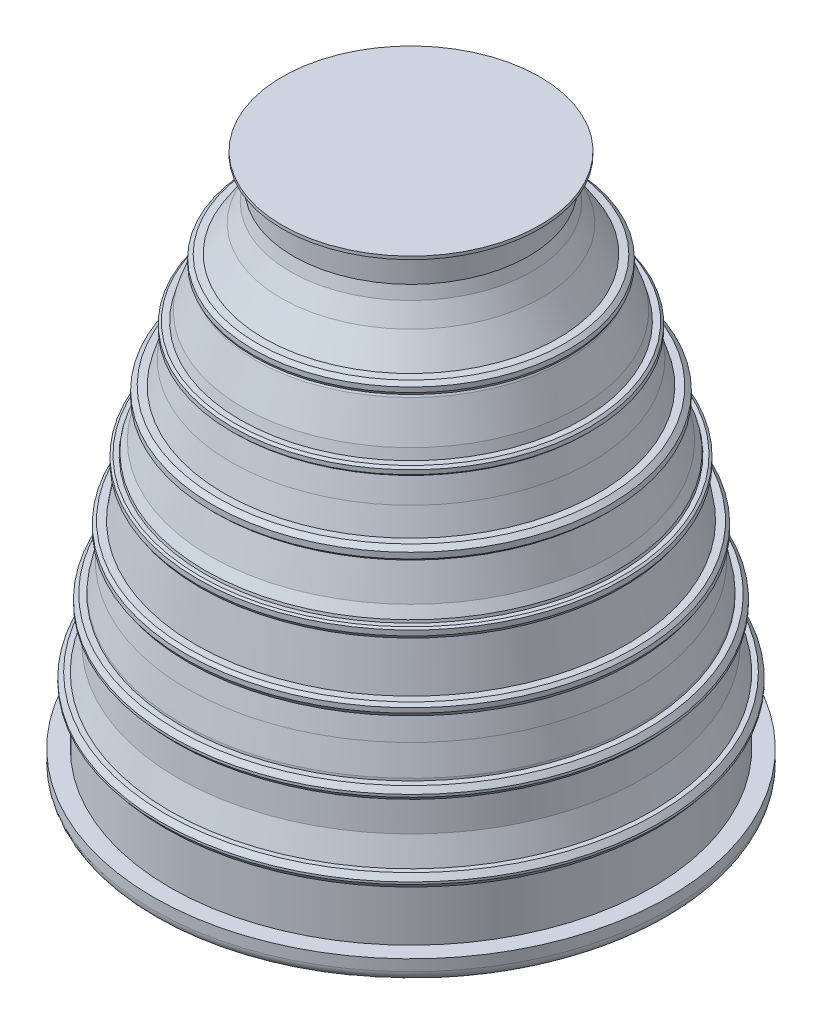
from build123d import *

# Parameters (mm, degrees)
SCALE2_SCALE = 0.6


# Read off the part's stored shape, not the designer's step: Revolve3
with BuildPart() as part:
    # Revolve3 outline → Revolve3 (revolve)
    with BuildSketch(Plane(origin=(2146.277660785, 0, 0), x_dir=(1, 0, 0), z_dir=(0, 0, 1))):
        with BuildLine():
            ThreePointArc((1951.536933898, 25.275712267), (2006.859500309, 51.03010733), (2029.401830459, 107.737413481))
            Line((2029.401830459, 107.737413481), (2029.401830459, 195.953154978))
            Line((2029.401830459, 195.953154978), (1898.0111499, 195.953154978))
            Line((1898.0111499, 195.953154978), (1898.0111499, 618.614307742))
            Line((1898.0111499, 618.614307742), (1935.123265413, 618.614307742))
            Line((1935.123265413, 618.614307742), (1967.950602382, 659.101356671))
            Line((1967.950602382, 659.101356671), (1967.950602382, 676.609269721))
            Line((1967.950602382, 676.609269721), (1935.123265413, 717.193939638))
            Line((1935.123265413, 717.193939638), (1898.0111499, 717.193939638))
            Line((1898.0111499, 717.193939638), (1833.922545223, 909.465155038))
            Line((1833.922545223, 909.465155038), (1813.953609607, 1154.269513894))
            Line((1813.953609607, 1154.269513894), (1846.189289159, 1154.269513894))
            Line((1846.189289159, 1154.269513894), (1880.516799695, 1192.507753479))
            Line((1880.516799695, 1192.507753479), (1880.516799695, 1212.061398721))
            Line((1880.516799695, 1212.061398721), (1850.969069107, 1251.622304154))
            Line((1850.969069107, 1251.622304154), (1806.012445447, 1251.622304154))
            Line((1806.012445447, 1251.622304154), (1804.657245809, 1268.236047856))
            Line((1804.657245809, 1268.236047856), (1759.13344672, 1480.680443604))
            Line((1759.13344672, 1480.680443604), (1722.553498139, 1657.496254903))
            Line((1722.553498139, 1657.496254903), (1752.051841719, 1657.496254903))
            Line((1752.051841719, 1657.496254903), (1775.244753449, 1691.570564677))
            Line((1775.244753449, 1691.570564677), (1775.244753449, 1729.357126839))
            Line((1775.244753449, 1729.357126839), (1752.051841719, 1752.550038568))
            Line((1752.051841719, 1752.550038568), (1696.601929641, 1752.550038568))
            Line((1696.601929641, 1752.550038568), (1636.556556345, 2123.295493405))
            Line((1636.556556345, 2123.295493405), (1660.36943769, 2123.295493405))
            Line((1660.36943769, 2123.295493405), (1677.205758617, 2149.347682028))
            Line((1677.205758617, 2149.347682028), (1677.205758617, 2189.578086415))
            Line((1677.205758617, 2189.578086415), (1660.36943769, 2200.45861958))
            Line((1660.36943769, 2200.45861958), (1625.798490416, 2200.45861958))
            Line((1625.798490416, 2200.45861958), (1621.886391778, 2221.004071879))
            Line((1621.886391778, 2221.004071879), (1580.637272399, 2297.176668723))
            Line((1580.637272399, 2297.176668723), (1500.064732486, 2567.904941416))
            Line((1500.064732486, 2567.904941416), (1536.675669529, 2567.904941416))
            Line((1536.675669529, 2567.904941416), (1562.041589628, 2593.270861514))
            Line((1562.041589628, 2593.270861514), (1562.041589628, 2638.989731947))
            Line((1562.041589628, 2638.989731947), (1525.504548665, 2669.841983248))
            Line((1525.504548665, 2669.841983248), (1469.726835783, 2669.841983248))
            Line((1469.726835783, 2669.841983248), (1414.545036921, 2855.255935771))
            Line((1414.545036921, 2855.255935771), (1363.523712468, 3042.133655208))
            Line((1363.523712468, 3042.133655208), (1390.817599511, 3042.133655208))
            Line((1390.817599511, 3042.133655208), (1408.169312383, 3059.48536808))
            Line((1408.169312383, 3059.48536808), (1408.169312383, 3092.910259985))
            Line((1408.169312383, 3092.910259985), (1390.817599511, 3110.261972858))
            Line((1390.817599511, 3110.261972858), (1344.923330305, 3110.261972858))
            Line((1344.923330305, 3110.261972858), (1324.590154146, 3184.737060096))
            Line((1324.590154146, 3184.737060096), (1225.273892586, 3457.073228648))
            Line((1225.273892586, 3457.073228648), (1210.601766313, 3482.896748881))
            Line((1210.601766313, 3482.896748881), (1234.038628603, 3482.896748881))
            Line((1234.038628603, 3482.896748881), (1244.233479215, 3503.285864136))
            Line((1244.233479215, 3503.285864136), (1244.233479215, 3541.601246474))
            Line((1244.233479215, 3541.601246474), (1213.639896375, 3567.434780912))
            Line((1213.639896375, 3567.434780912), (1157.54853392, 3572.417612227))
            Line((1157.54853392, 3572.417612227), (1024.378946718, 3780.741450818))
            Line((1024.378946718, 3780.741450818), (951.465506267, 3924.680681197))
            Line((951.465506267, 3924.680681197), (926.267371562, 4016.974834635))
            Line((926.267371562, 4016.974834635), (926.267371562, 4231.26723546))
            Line((926.267371562, 4231.26723546), (1014.05745818, 4247.753437864))
            Line((1014.05745818, 4247.753437864), (1014.05745818, 4271.986586525))
            Line((1014.05745818, 4271.986586525), (0, 4271.986586525))
            Line((0, 4271.986586525), (0, 4231.26723546))
            Line((0, 4231.26723546), (808.309615376, 4231.26723546))
            Line((808.309615376, 4231.26723546), (821.240800447, 4040.05764866))
            Line((821.240800447, 4040.05764866), (836.911498372, 3959.664161501))
            Line((836.911498372, 3959.664161501), (857.080804033, 3902.351183577))
            Line((857.080804033, 3902.351183577), (926.267371562, 3758.540440497))
            Line((926.267371562, 3758.540440497), (956.505591549, 3706.751934895))
            Line((956.505591549, 3706.751934895), (1087.342551957, 3513.639900071))
            Line((1087.342551957, 3513.639900071), (1146.968075009, 3411.520240383))
            Line((1146.968075009, 3411.520240383), (1255.169835341, 3104.054767564))
            Line((1255.169835341, 3104.054767564), (1414.545036921, 2567.904941416))
            Line((1414.545036921, 2567.904941416), (1495.371217617, 2264.404240867))
            Line((1495.371217617, 2264.404240867), (1581.941736744, 1898.582092252))
            Line((1581.941736744, 1898.582092252), (1667.239575845, 1460.988899845))
            Line((1667.239575845, 1460.988899845), (1711.484560073, 1254.512306782))
            Line((1711.484560073, 1254.512306782), (1741.176324893, 890.513263993))
            Line((1741.176324893, 890.513263993), (1804.0311499, 701.943491585))
            Line((1804.0311499, 701.943491585), (1804.0311499, 25.275712267))
            Line((1804.0311499, 25.275712267), (1951.536933898, 25.275712267))
        make_face()
    revolve(axis=Axis((2146.277660785, 0, 0), (0, 1, 0)))


with BuildPart() as part_1:
    # Scale2: scaled about (2146.277660785, 1872.972543286, 0)
    add(part.part.scale(SCALE2_SCALE).moved(Location((858.511064314, 749.189017314, 0))))


solid = part_1.part
